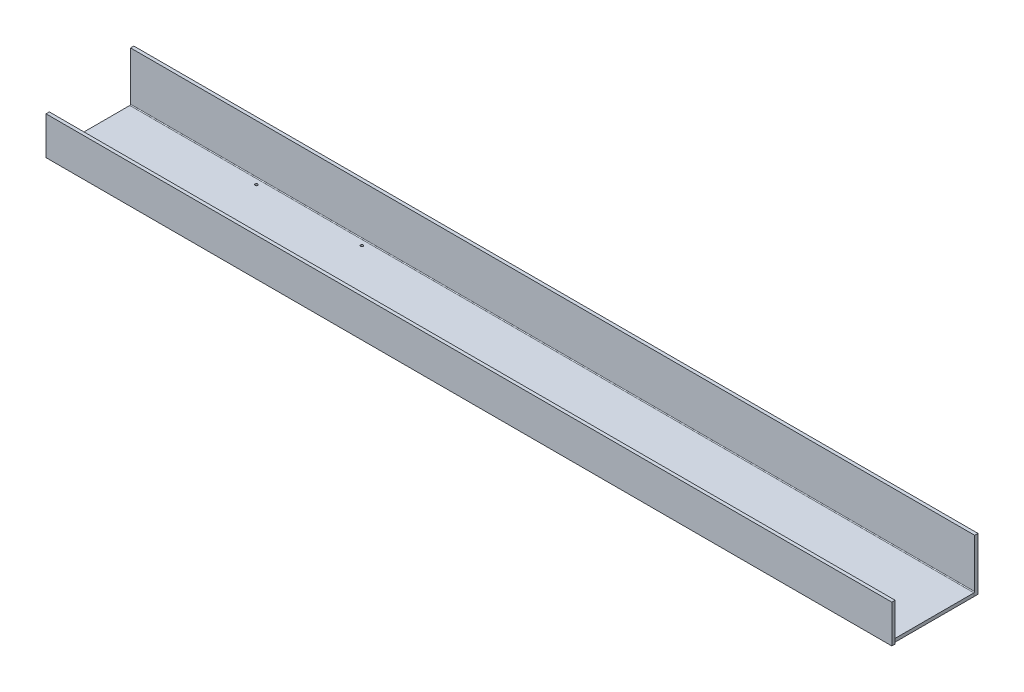
from build123d import *

# Parameters (mm, degrees)
SKETCH1_W                    = 812.8
SKETCH1_H                    = 78.232
BOSS_EXTRUDE1_DEPTH          = 3.175
EDGE_FLANGE1_STRIP_W         = 14.224
EDGE_FLANGE1_STRIP_H         = 3.175
EDGE_FLANGE1_STRIP_CUT_DEPTH = 812.8
EDGE_FLANGE1_DEPTH           = 812.8
EDGE_FLANGE2_STRIP_W         = 14.224
EDGE_FLANGE2_STRIP_H         = 3.175
EDGE_FLANGE2_STRIP_CUT_DEPTH = 812.8
EDGE_FLANGE2_DEPTH           = 812.8
SKETCH9_R                    = 2.667
CUT_EXTRUDE1_DEPTH           = 818.620012948
CHAMFER1_SIZE                = 3.175
SKETCH12_R                   = 1.27
CUT_EXTRUDE4_DEPTH           = 818.20071162
SKETCH15_W                   = 812.8
SKETCH15_H                   = 50.8
BOSS_EXTRUDE2_DEPTH          = 3.175
SKETCH16_W                   = 814.386282527
SKETCH16_H                   = 36.576
BOSS_EXTRUDE3_DEPTH          = 3.175


# Sheet-metal steps are written as plain solids
with BuildPart() as part:
    # Sketch1 → Boss-Extrude1 (new body)
    with BuildSketch(Plane(origin=(0, 0, 0), x_dir=(1, 0, 0), z_dir=(0, 1, 0))):
        with Locations((406.4, 39.116)):
            Rectangle(SKETCH1_W, SKETCH1_H)
    extrude(amount=BOSS_EXTRUDE1_DEPTH)

    # Edge-Flange1 strip (across the edge) → Edge-Flange1 strip cut (cut)
    with BuildSketch(Plane(origin=(812.8, 3.175, -78.232), x_dir=(0, 0, 1), z_dir=(-1, 0, 0))):
        with Locations((-6.35, -1.5875)):
            Rectangle(EDGE_FLANGE1_STRIP_W, EDGE_FLANGE1_STRIP_H)
    extrude(amount=EDGE_FLANGE1_STRIP_CUT_DEPTH, mode=Mode.SUBTRACT)

    # Edge-Flange1 section (across the edge) → Edge-Flange1 (add)
    with BuildSketch(Plane(origin=(812.8, 3.175, -78.232), x_dir=(0, 0, 1), z_dir=(-1, 0, 0))):
        with BuildLine():
            Line((-3.175, 0.762), (-3.175, 23.368))
            Line((-3.175, 23.368), (0, 23.368))
            Line((0, 23.368), (0, 0.762))
            ThreePointArc((0, 0.762), (0.223184633, 0.223184633), (0.762, 0))
            Line((0.762, 0), (0.762, -3.175))
            ThreePointArc((0.762, -3.175), (-2.021879398, -2.021879398), (-3.175, 0.762))
        make_face()
    extrude(amount=EDGE_FLANGE1_DEPTH)

    # Edge-Flange2 strip (across the edge) → Edge-Flange2 strip cut (cut)
    with BuildSketch(Plane(origin=(0, 3.175, 0), x_dir=(0, 0, -1), z_dir=(1, 0, 0))):
        with Locations((-6.35, -1.5875)):
            Rectangle(EDGE_FLANGE2_STRIP_W, EDGE_FLANGE2_STRIP_H)
    extrude(amount=EDGE_FLANGE2_STRIP_CUT_DEPTH, mode=Mode.SUBTRACT)

    # Edge-Flange2 section (across the edge) → Edge-Flange2 (add)
    with BuildSketch(Plane(origin=(0, 3.175, 0), x_dir=(0, 0, -1), z_dir=(1, 0, 0))):
        with BuildLine():
            Line((-3.175, 0.762), (-3.175, 23.368))
            Line((-3.175, 23.368), (0, 23.368))
            Line((0, 23.368), (0, 0.762))
            ThreePointArc((0, 0.762), (0.223184633, 0.223184633), (0.762, 0))
            Line((0.762, 0), (0.762, -3.175))
            ThreePointArc((0.762, -3.175), (-2.021879398, -2.021879398), (-3.175, 0.762))
        make_face()
    extrude(amount=EDGE_FLANGE2_DEPTH)

    # Sketch9 → Cut-Extrude1 (cut, through all)
    with BuildSketch(Plane.XY.offset(3.175)):
        with Locations((806.45, 16.637)):
            Circle(SKETCH9_R)
    extrude(amount=-CUT_EXTRUDE1_DEPTH, mode=Mode.SUBTRACT)

    # Chamfer1
    chamfer1_edges = [part.edges().sort_by_distance(p)[0] for p in [
        (812.8, 26.543, -79.8195),
        (0, 26.543, -79.8195),
        (0, 26.543, 1.5875),
        (812.8, 26.543, 1.5875),
    ]]
    chamfer(chamfer1_edges, length=CHAMFER1_SIZE)

    # Sketch12 → Cut-Extrude4 (cut, through all)
    with BuildSketch(Plane(origin=(0, 3.175, 0), x_dir=(1, 0, 0), z_dir=(0, 1, 0))):
        with Locations(Location((127, 72.39, 0), (0, 0, 270))):
            Circle(SKETCH12_R)
        with Locations(Location((228.6, 72.39, 0), (0, 0, 270))):
            Circle(SKETCH12_R)
        with Locations(Location((228.6, 5.842, 0), (0, 0, 270))):
            Circle(SKETCH12_R)
        with Locations(Location((127, 5.842, 0), (0, 0, 270))):
            Circle(SKETCH12_R)
    extrude(amount=-CUT_EXTRUDE4_DEPTH, mode=Mode.SUBTRACT)

    # Sketch15 → Boss-Extrude2 (add)
    with BuildSketch(Plane(origin=(0, 0, -81.407), x_dir=(-1, 0, 0), z_dir=(0, 0, -1))):
        with Locations((-406.4, 25.4)):
            Rectangle(SKETCH15_W, SKETCH15_H)
    extrude(amount=-BOSS_EXTRUDE2_DEPTH)

    # Sketch16 → Boss-Extrude3 (add)
    with BuildSketch(Plane.XY.offset(3.175)):
        with Locations((407.193141264, 18.288)):
            Rectangle(SKETCH16_W, SKETCH16_H)
    extrude(amount=-BOSS_EXTRUDE3_DEPTH)


solid = part.part
